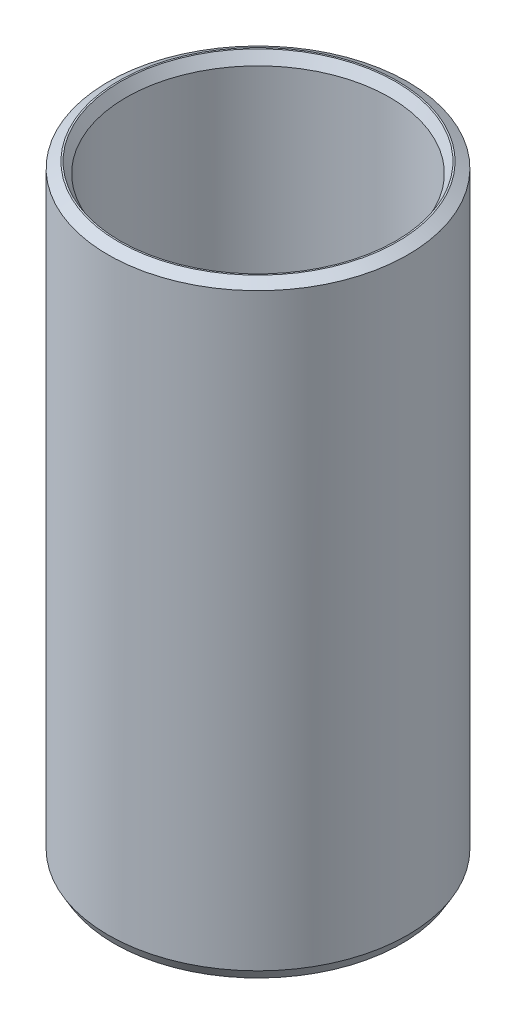
from build123d import *
from OCP.BRepFilletAPI import BRepFilletAPI_MakeChamfer

# Parameters (mm, degrees)
SKETCH1_R           = 55
BOSS_EXTRUDE1_DEPTH = 222.255829095
SKETCH2_R           = 48.379631562
CUT_EXTRUDE1_DEPTH  = 236.473254462
CHAMFER1_SIZE       = 2.219764976
CHAMFER1_SIZE2      = 3.844745719


with BuildPart() as part:
    # Sketch1 → Boss-Extrude1 (new body)
    with BuildSketch(Plane(origin=(0, 0, 0), x_dir=(1, 0, 0), z_dir=(0, 1, 0))):
        Circle(SKETCH1_R)
    extrude(amount=BOSS_EXTRUDE1_DEPTH)

    # Sketch2 → Cut-Extrude1 (cut, through all)
    with BuildSketch(Plane(origin=(0, 0, 0), x_dir=(1, 0, 0), z_dir=(0, 1, 0))):
        Circle(SKETCH2_R)
    extrude(amount=CUT_EXTRUDE1_DEPTH, mode=Mode.SUBTRACT)

    # Chamfer1: one chamfer whose edges measure the first distance from different faces: ONE call of the kernel's chamfer builder (chamfer() names one face for all edges)
    chamfer1_edges_1 = [part.edges().sort_by_distance(p)[0] for p in [
        (-48.379631562, 222.255829095, 0),
    ]]
    chamfer1_side_1 = [part.faces().sort_by_distance(p)[0] for p in [
        (-53.444365081, 222.255829095, 0),
    ]]
    chamfer1_edges_2 = [part.edges().sort_by_distance(p)[0] for p in [
        (-48.379631562, 0, 0),
    ]]
    chamfer1_side_2 = [part.faces().sort_by_distance(p)[0] for p in [
        (-48.379631562, 111.127914548, 0),
    ]]
    chamfer1_edges_3 = [part.edges().sort_by_distance(p)[0] for p in [
        (-55, 0, 0),
    ]]
    chamfer1_side_3 = [part.faces().sort_by_distance(p)[0] for p in [
        (-53.444365081, 0, 0),
    ]]
    chamfer1_edges_4 = [part.edges().sort_by_distance(p)[0] for p in [
        (-55, 222.255829095, 0),
    ]]
    chamfer1_side_4 = [part.faces().sort_by_distance(p)[0] for p in [
        (-55, 111.127914548, 0),
    ]]
    chamfer1 = BRepFilletAPI_MakeChamfer(part.part.solid().wrapped)
    for e in chamfer1_edges_1:
        chamfer1.Add(CHAMFER1_SIZE, CHAMFER1_SIZE2, e.wrapped, chamfer1_side_1[0].wrapped)  # the first distance lies on this face
    for e in chamfer1_edges_2:
        chamfer1.Add(CHAMFER1_SIZE, CHAMFER1_SIZE2, e.wrapped, chamfer1_side_2[0].wrapped)  # the first distance lies on this face
    for e in chamfer1_edges_3:
        chamfer1.Add(CHAMFER1_SIZE, CHAMFER1_SIZE2, e.wrapped, chamfer1_side_3[0].wrapped)  # the first distance lies on this face
    for e in chamfer1_edges_4:
        chamfer1.Add(CHAMFER1_SIZE, CHAMFER1_SIZE2, e.wrapped, chamfer1_side_4[0].wrapped)  # the first distance lies on this face
    add(Compound.cast(chamfer1.Shape()), mode=Mode.REPLACE)


solid = part.part
